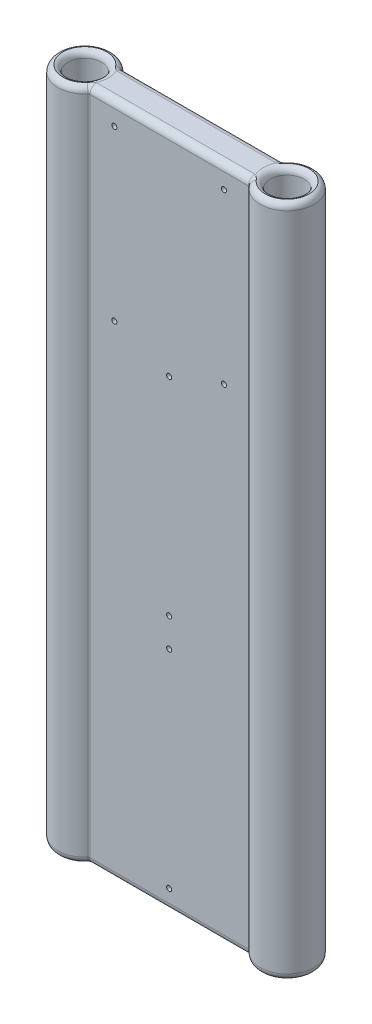
from build123d import *

# Parameters (mm, degrees)
SKETCH1_R               = 6.35000000000001
SKETCH1_R_2             = 6.350000000000002
BOSS_EXTRUDE1_DEPTH     = 127
FILLET1_R               = 2.54
CUT_EXTRUDE1_DEPTH      = 3.8099999999999996
CUT_EXTRUDE1_DEPTH_BACK = 3.8099999999999996
SKETCH2_R               = 0.952499999999999
SKETCH2_R_2             = 0.9525
SKETCH2_R_3             = 0.9525000000000002
SKETCH2_R_4             = 0.9524999999999982
SKETCH3_R               = 0.9525000000000009
SKETCH3_R_2             = 0.9524999999999989
SKETCH3_R_3             = 0.9524999999999999
SKETCH3_R_4             = 0.952499999999999
CUT_EXTRUDE2_DEPTH      = 3.8099999999999996


with BuildPart() as part:
    # Sketch1 → Boss-Extrude1 (new, symmetric)
    with BuildSketch(Plane(origin=(0, 0, 0), x_dir=(1, 0, 0), z_dir=(0, 1, 0))):
        with BuildLine():
            Line((29.845, -6.35), (-29.844999999999995, -6.349999999999999))
            ThreePointArc((-29.844999999999995, -6.349999999999999), (-30.133277104578895, -6.413316273412398), (-30.368487804878054, -6.591609756097566))
            ThreePointArc((-30.368487804878054, -6.591609756097566), (-41.61236644568732, -9.533566066861315), (-48.260000000000026, 2.9661e-12))
            ThreePointArc((-48.260000000000026, 2.9661e-12), (-41.61236644568456, 9.533566066862377), (-30.368487804878054, 6.591609756097566))
            ThreePointArc((-30.368487804878054, 6.591609756097566), (-30.133277104578895, 6.413316273412398), (-29.844999999999995, 6.349999999999999))
            Line((-29.844999999999995, 6.349999999999999), (29.845, 6.35))
            ThreePointArc((29.845, 6.35), (30.133277104578898, 6.4133162734123985), (30.368487804878054, 6.591609756097566))
            ThreePointArc((30.368487804878054, 6.591609756097566), (41.612366445686106, 9.533566066861773), (48.26, -3.4895e-13))
            ThreePointArc((48.26, -3.4895e-13), (41.61236644568578, -9.533566066861898), (30.368487804878054, -6.591609756097566))
            ThreePointArc((30.368487804878054, -6.591609756097566), (30.133277104578895, -6.413316273412399), (29.845, -6.35))
        make_face()
        with Locations(Location((38.1, 0, 0), (0, 0, 270))):
            Circle(SKETCH1_R, mode=Mode.SUBTRACT)
        with Locations(Location((-38.09999999999999, -9.33e-15, 0), (0, 0, 90))):
            Circle(SKETCH1_R_2, mode=Mode.SUBTRACT)
    extrude(amount=BOSS_EXTRUDE1_DEPTH, both=True)

    # Fillet1
    # the kernel refuses this fillet: 2.54 mm, written as the material it takes off along each edge
    with BuildSketch(Plane(origin=(38.1, -127, 5.33e-15), x_dir=(-0.7609756097560968, 0, -0.6487804878048788), z_dir=(-0.6487804878048788, 0, 0.7609756097560968))) as fillet1_piece_1:
        with BuildLine():
            CenterArc((10.160000000000002 - FILLET1_R, -FILLET1_R), FILLET1_R, 0, 90)
            Line((10.160000000000002 - FILLET1_R, 0), (10.160000000000002, 0))
            Line((10.160000000000002, 0), (10.160000000000002, -FILLET1_R))
        make_face()
    revolve(axis=Axis((38.1, -127, 5.33e-15), (0, -1, 0)), revolution_arc=139.5502811376657, mode=Mode.SUBTRACT)
    with BuildSketch(Plane(origin=(29.84499999999999, -127, 7.037916666666687), x_dir=(0.7609756097560946, 0, -0.6487804878048815), z_dir=(0.6487804878048815, 0, 0.7609756097560946))) as fillet1_piece_2:
        with BuildLine():
            CenterArc((0.6879166666666876 + FILLET1_R, FILLET1_R), FILLET1_R, 180, 90)
            Line((0.6879166666666876 + FILLET1_R, 0), (0.6879166666666876, 0))
            Line((0.6879166666666876, 0), (0.6879166666666888, FILLET1_R))
        make_face()
    revolve(axis=Axis((29.84499999999999, -127, 7.037916666666687), (0, 1, 0)), revolution_arc=49.55028113766299, mode=Mode.SUBTRACT)
    with BuildSketch(Plane(origin=(29.845, -127, 6.35), x_dir=(1e-17, 0, -1), z_dir=(-1, 0, -1e-17)), Plane(origin=(-29.844999999999995, -127, -6.349999999999999), x_dir=(1e-17, 0, 1), z_dir=(1, 0, -1e-17))) as fillet1_piece_3:
        with BuildLine():
            CenterArc((FILLET1_R, -FILLET1_R), FILLET1_R, 90, 90)
            Line((0, -FILLET1_R), (0, 0))
            Line((0, 0), (FILLET1_R, 0))
        make_face()
    extrude(amount=59.69, mode=Mode.SUBTRACT)
    with BuildSketch(Plane(origin=(-29.845, -127, 7.037916666666673), x_dir=(5.16e-15, 0, -1), z_dir=(1, 0, 5.16e-15))) as fillet1_piece_4:
        with BuildLine():
            CenterArc((0.6879166666666734 + FILLET1_R, FILLET1_R), FILLET1_R, 180, 90)
            Line((0.6879166666666734, FILLET1_R), (0.6879166666666734, 0))
            Line((0.6879166666666734, 0), (0.6879166666666734 + FILLET1_R, 0))
        make_face()
    revolve(axis=Axis((-29.845, -127, 7.037916666666673), (0, 1, 0)), revolution_arc=49.550281137664385, mode=Mode.SUBTRACT)
    with BuildSketch(Plane(origin=(-38.099999999999994, -127, -4.574e-14), x_dir=(0.7609756097560946, 0, 0.6487804878048816), z_dir=(0.6487804878048816, 0, -0.7609756097560946))) as fillet1_piece_5:
        with BuildLine():
            CenterArc((10.16000000000003 - FILLET1_R, -FILLET1_R), FILLET1_R, 0, 90)
            Line((10.16000000000003, -FILLET1_R), (10.16000000000003, 0))
            Line((10.16000000000003, 0), (10.16000000000003 - FILLET1_R, 0))
        make_face()
    revolve(axis=Axis((-38.099999999999994, -127, -4.574e-14), (0, -1, 0)), revolution_arc=139.55028113768003, mode=Mode.SUBTRACT)
    with BuildSketch(Plane(origin=(-29.845, -127, -7.037916666666672), x_dir=(-0.7609756097561005, 0, 0.6487804878048747), z_dir=(-0.6487804878048747, 0, -0.7609756097561005))) as fillet1_piece_6:
        with BuildLine():
            CenterArc((0.6879166666666725 + FILLET1_R, FILLET1_R), FILLET1_R, 180, 90)
            Line((0.687916666666671, FILLET1_R), (0.6879166666666725, 0))
            Line((0.6879166666666725, 0), (0.6879166666666725 + FILLET1_R, 0))
        make_face()
    revolve(axis=Axis((-29.845, -127, -7.037916666666672), (0, 1, 0)), revolution_arc=49.55028113766444, mode=Mode.SUBTRACT)
    with BuildSketch(Plane(origin=(-29.844999999999995, 127, -6.349999999999999), x_dir=(1e-17, 0, 1), z_dir=(1, 0, -1e-17)), Plane(origin=(29.845, 127, 6.35), x_dir=(1e-17, 0, -1), z_dir=(-1, 0, -1e-17))) as fillet1_piece_7:
        with BuildLine():
            CenterArc((FILLET1_R, FILLET1_R), FILLET1_R, 180, 90)
            Line((0, FILLET1_R), (0, 0))
            Line((0, 0), (FILLET1_R, 0))
        make_face()
    extrude(amount=59.69, mode=Mode.SUBTRACT)
    with BuildSketch(Plane(origin=(29.845000000000002, -127, -7.037916666666662), x_dir=(-5.16e-15, 0, 1), z_dir=(-1, 0, -5.16e-15))) as fillet1_piece_8:
        with BuildLine():
            CenterArc((0.6879166666666627 + FILLET1_R, FILLET1_R), FILLET1_R, 180, 90)
            Line((0.6879166666666627, FILLET1_R), (0.6879166666666627, 0))
            Line((0.6879166666666627, 0), (0.6879166666666627 + FILLET1_R, 0))
        make_face()
    revolve(axis=Axis((29.845000000000002, -127, -7.037916666666662), (0, 1, 0)), revolution_arc=49.55028113766487, mode=Mode.SUBTRACT)
    with BuildSketch(Plane(origin=(-29.845, 127, -7.037916666666672), x_dir=(-0.7609756097561005, 0, 0.6487804878048747), z_dir=(-0.6487804878048747, 0, -0.7609756097561005))) as fillet1_piece_9:
        with BuildLine():
            CenterArc((0.6879166666666725 + FILLET1_R, -FILLET1_R), FILLET1_R, 90, 90)
            Line((0.687916666666671, -FILLET1_R), (0.6879166666666725, 0))
            Line((0.6879166666666725, 0), (0.6879166666666725 + FILLET1_R, 0))
        make_face()
    revolve(axis=Axis((-29.845, 127, -7.037916666666672), (0, 1, 0)), revolution_arc=49.55028113766444, mode=Mode.SUBTRACT)
    with BuildSketch(Plane(origin=(-38.099999999999994, 127, -4.574e-14), x_dir=(0.7609756097560946, 0, 0.6487804878048816), z_dir=(0.6487804878048816, 0, -0.7609756097560946))) as fillet1_piece_10:
        with BuildLine():
            CenterArc((10.16000000000003 - FILLET1_R, FILLET1_R), FILLET1_R, 270, 90)
            Line((10.16000000000003, FILLET1_R), (10.16000000000003, 0))
            Line((10.16000000000003, 0), (10.16000000000003 - FILLET1_R, 0))
        make_face()
    revolve(axis=Axis((-38.099999999999994, 127, -4.574e-14), (0, -1, 0)), revolution_arc=139.55028113768003, mode=Mode.SUBTRACT)
    with BuildSketch(Plane(origin=(-38.09999999999999, -127, 9.33e-15), x_dir=(0, 0, -1), z_dir=(1, 0, 0))) as fillet1_piece_11:
        with BuildLine():
            CenterArc((6.350000000000002 + FILLET1_R, FILLET1_R), FILLET1_R, 180, 90)
            Line((6.350000000000001, FILLET1_R), (6.350000000000002, 0))
            Line((6.350000000000002, 0), (6.350000000000002 + FILLET1_R, 0))
        make_face()
    revolve(axis=Axis((-38.09999999999999, -127, 9.33e-15), (0, 1, 0)), mode=Mode.SUBTRACT)
    with BuildSketch(Plane(origin=(-38.09999999999999, 127, 9.33e-15), x_dir=(0, 0, -1), z_dir=(1, 0, 0))) as fillet1_piece_12:
        with BuildLine():
            CenterArc((6.350000000000002 + FILLET1_R, -FILLET1_R), FILLET1_R, 90, 90)
            Line((6.350000000000001, -FILLET1_R), (6.350000000000002, 0))
            Line((6.350000000000002, 0), (6.350000000000002 + FILLET1_R, 0))
        make_face()
    revolve(axis=Axis((-38.09999999999999, 127, 9.33e-15), (0, 1, 0)), mode=Mode.SUBTRACT)
    with BuildSketch(Plane(origin=(-29.845, 127, 7.037916666666673), x_dir=(5.16e-15, 0, -1), z_dir=(1, 0, 5.16e-15))) as fillet1_piece_13:
        with BuildLine():
            CenterArc((0.6879166666666734 + FILLET1_R, -FILLET1_R), FILLET1_R, 90, 90)
            Line((0.6879166666666734, -FILLET1_R), (0.6879166666666734, 0))
            Line((0.6879166666666734, 0), (0.6879166666666734 + FILLET1_R, 0))
        make_face()
    revolve(axis=Axis((-29.845, 127, 7.037916666666673), (0, 1, 0)), revolution_arc=49.550281137664385, mode=Mode.SUBTRACT)
    with BuildSketch(Plane(origin=(38.1, -127, 0), x_dir=(0, 0, 1), z_dir=(-1, 0, 0))) as fillet1_piece_14:
        with BuildLine():
            CenterArc((6.35000000000001 + FILLET1_R, FILLET1_R), FILLET1_R, 180, 90)
            Line((6.350000000000009, FILLET1_R), (6.35000000000001, 0))
            Line((6.35000000000001, 0), (6.35000000000001 + FILLET1_R, 0))
        make_face()
    revolve(axis=Axis((38.1, -127, 0), (0, 1, 0)), mode=Mode.SUBTRACT)
    with BuildSketch(Plane(origin=(38.1, 127, 0), x_dir=(0, 0, 1), z_dir=(-1, 0, 0))) as fillet1_piece_15:
        with BuildLine():
            CenterArc((6.35000000000001 + FILLET1_R, -FILLET1_R), FILLET1_R, 90, 90)
            Line((6.350000000000009, -FILLET1_R), (6.35000000000001, 0))
            Line((6.35000000000001, 0), (6.35000000000001 + FILLET1_R, 0))
        make_face()
    revolve(axis=Axis((38.1, 127, 0), (0, 1, 0)), mode=Mode.SUBTRACT)
    with BuildSketch(Plane(origin=(29.84499999999999, 127, 7.037916666666687), x_dir=(0.7609756097560946, 0, -0.6487804878048815), z_dir=(0.6487804878048815, 0, 0.7609756097560946))) as fillet1_piece_16:
        with BuildLine():
            CenterArc((0.6879166666666876 + FILLET1_R, -FILLET1_R), FILLET1_R, 90.00000000000003, 90)
            Line((0.6879166666666876 + FILLET1_R, 0), (0.6879166666666876, 0))
            Line((0.6879166666666876, 0), (0.6879166666666888, -FILLET1_R))
        make_face()
    revolve(axis=Axis((29.84499999999999, 127, 7.037916666666687), (0, 1, 0)), revolution_arc=49.55028113766299, mode=Mode.SUBTRACT)
    with BuildSketch(Plane(origin=(38.1, 127, 5.33e-15), x_dir=(-0.7609756097560968, 0, -0.6487804878048788), z_dir=(-0.6487804878048788, 0, 0.7609756097560968))) as fillet1_piece_17:
        with BuildLine():
            CenterArc((10.160000000000002 - FILLET1_R, FILLET1_R), FILLET1_R, 270, 90)
            Line((10.160000000000002 - FILLET1_R, 0), (10.160000000000002, 0))
            Line((10.160000000000002, 0), (10.160000000000002, FILLET1_R))
        make_face()
    revolve(axis=Axis((38.1, 127, 5.33e-15), (0, -1, 0)), revolution_arc=139.5502811376657, mode=Mode.SUBTRACT)
    with BuildSketch(Plane(origin=(29.845000000000002, 127, -7.037916666666662), x_dir=(-5.16e-15, 0, 1), z_dir=(-1, 0, -5.16e-15))) as fillet1_piece_18:
        with BuildLine():
            CenterArc((0.6879166666666627 + FILLET1_R, -FILLET1_R), FILLET1_R, 90, 90)
            Line((0.6879166666666627, -FILLET1_R), (0.6879166666666627, 0))
            Line((0.6879166666666627, 0), (0.6879166666666627 + FILLET1_R, 0))
        make_face()
    revolve(axis=Axis((29.845000000000002, 127, -7.037916666666662), (0, 1, 0)), revolution_arc=49.55028113766487, mode=Mode.SUBTRACT)
    with BuildSketch(Plane(origin=(38.1, 127, 6.22e-15), x_dir=(1, 0, 3.373e-14), z_dir=(3.373e-14, 0, -1))) as fillet1_piece_19:
        with BuildLine():
            CenterArc((10.15999999999999 - FILLET1_R, FILLET1_R), FILLET1_R, 269.99999999999983, 90.00000000000017)
            Line((10.15999999999999 - FILLET1_R, 0), (10.15999999999999, 0))
            Line((10.15999999999999, 0), (10.159999999999997, FILLET1_R))
        make_face()
    revolve(axis=Axis((38.1, 127, 6.22e-15), (0, -1, 0)), revolution_arc=139.5502811376619, mode=Mode.SUBTRACT)
    with BuildSketch(Plane(origin=(-38.10000000000002, 127, -1.954e-14), x_dir=(-1, 0, -2.9002e-13), z_dir=(-2.9002e-13, 0, 1))) as fillet1_piece_20:
        with BuildLine():
            CenterArc((10.159999999999997 - FILLET1_R, FILLET1_R), FILLET1_R, 270, 90)
            Line((10.159999999999997, FILLET1_R), (10.159999999999997, 0))
            Line((10.159999999999997, 0), (10.159999999999997 - FILLET1_R, 0))
        make_face()
    revolve(axis=Axis((-38.10000000000002, 127, -1.954e-14), (0, -1, 0)), revolution_arc=139.55028113764735, mode=Mode.SUBTRACT)
    with BuildSketch(Plane(origin=(-38.10000000000002, -127, -1.954e-14), x_dir=(-1, 0, -2.9002e-13), z_dir=(-2.9002e-13, 0, 1))) as fillet1_piece_21:
        with BuildLine():
            CenterArc((10.159999999999997 - FILLET1_R, -FILLET1_R), FILLET1_R, 0, 90)
            Line((10.159999999999997, -FILLET1_R), (10.159999999999997, 0))
            Line((10.159999999999997, 0), (10.159999999999997 - FILLET1_R, 0))
        make_face()
    revolve(axis=Axis((-38.10000000000002, -127, -1.954e-14), (0, -1, 0)), revolution_arc=139.55028113764735, mode=Mode.SUBTRACT)
    with BuildSketch(Plane(origin=(38.1, -127, 6.22e-15), x_dir=(1, 0, 3.373e-14), z_dir=(3.373e-14, 0, -1))) as fillet1_piece_22:
        with BuildLine():
            CenterArc((10.15999999999999 - FILLET1_R, -FILLET1_R), FILLET1_R, 0, 90.00000000000017)
            Line((10.15999999999999 - FILLET1_R, 0), (10.15999999999999, 0))
            Line((10.15999999999999, 0), (10.159999999999997, -FILLET1_R))
        make_face()
    revolve(axis=Axis((38.1, -127, 6.22e-15), (0, -1, 0)), revolution_arc=139.5502811376619, mode=Mode.SUBTRACT)

    # Sketch2 → Cut-Extrude1 (cut, two sides: drawn at the far end of the back side and taken through both)
    with BuildSketch(Plane(origin=(-9e-17, 0, -6.35), x_dir=(-1, 0, 1e-17), z_dir=(-1e-17, 0, -1)).offset(-CUT_EXTRUDE1_DEPTH_BACK)):
        with Locations(Location((-27.051, 97.92555570101196, 0), (0, 0, 180))):
            Circle(SKETCH2_R)
        with Locations(Location((27.051, 97.92555570101196, 0), (0, 0, 180))):
            Circle(SKETCH2_R)
        with Locations(Location((27.051, 3.9455557010119464, 0), (0, 0, 180))):
            Circle(SKETCH2_R_2)
        with Locations(Location((-27.051, 3.9455557010119464, 0), (0, 0, 180))):
            Circle(SKETCH2_R_2)
        with Locations(Location((-0.9658394107816982, -15.274258888723399, 0), (0, 0, 180))):
            Circle(SKETCH2_R_3)
        with Locations(Location((-0.9658394107816981, -93.36217534875225, 0), (0, 0, 180))):
            Circle(SKETCH2_R_4)
    extrude(amount=CUT_EXTRUDE1_DEPTH + CUT_EXTRUDE1_DEPTH_BACK, mode=Mode.SUBTRACT)

    # Sketch3 → Cut-Extrude2 (cut)
    with BuildSketch(Plane.XY.offset(6.349999999999999)):
        with Locations((0, -41.52831500287881)):
            Circle(SKETCH3_R)
        with Locations((0, -119.61623146290765)):
            Circle(SKETCH3_R_2)
        with Locations((0, 47.39841049257693)):
            Circle(SKETCH3_R)
        with Locations((0, -30.689505967451915)):
            Circle(SKETCH3_R_3)
        with Locations((-20.637500000000003, 118.67591072761769)):
            Circle(SKETCH3_R_4)
        with Locations((20.637499999999996, 118.67591072761769)):
            Circle(SKETCH3_R_4)
        with Locations((20.637499999999996, 55.17591072761768)):
            Circle(SKETCH3_R_4)
        with Locations((-20.637500000000003, 55.17591072761768)):
            Circle(SKETCH3_R_4)
    extrude(amount=-CUT_EXTRUDE2_DEPTH, mode=Mode.SUBTRACT)


solid = part.part
